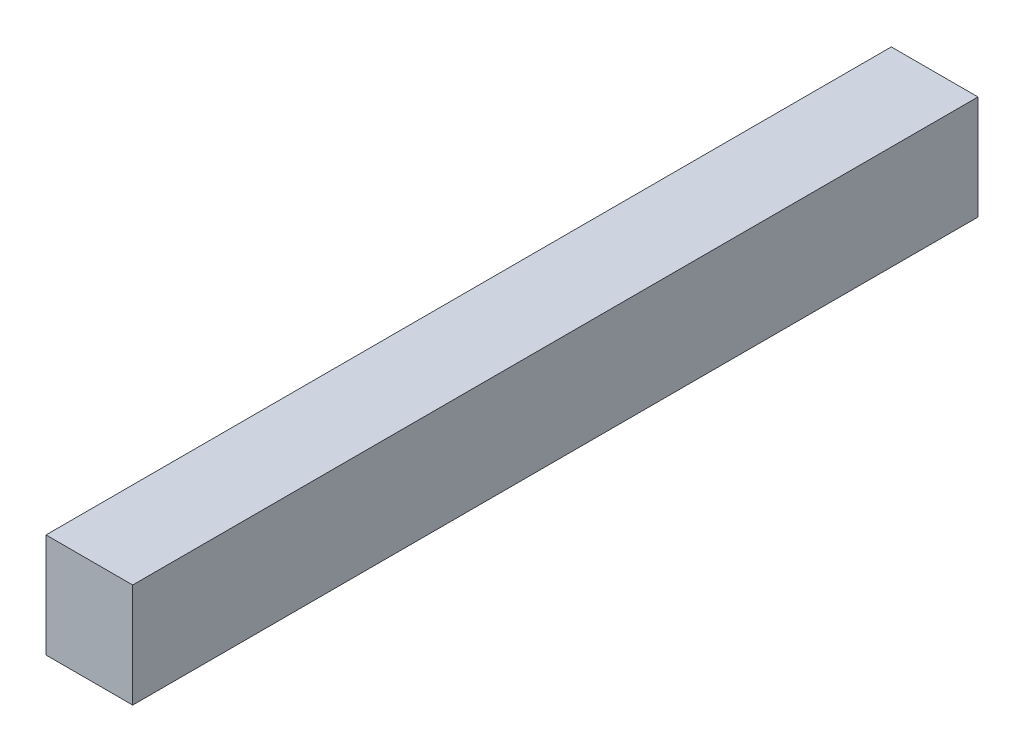
from build123d import *

# Parameters (mm, degrees)
SKETCH1_W           = 2
SKETCH1_H           = 2.4
BOSS_EXTRUDE1_DEPTH = 19.5


with BuildPart() as part:
    # Sketch1 → Boss-Extrude1 (new body)
    with BuildSketch(Plane.XY):
        Rectangle(SKETCH1_W, SKETCH1_H)
    extrude(amount=BOSS_EXTRUDE1_DEPTH)


solid = part.part
